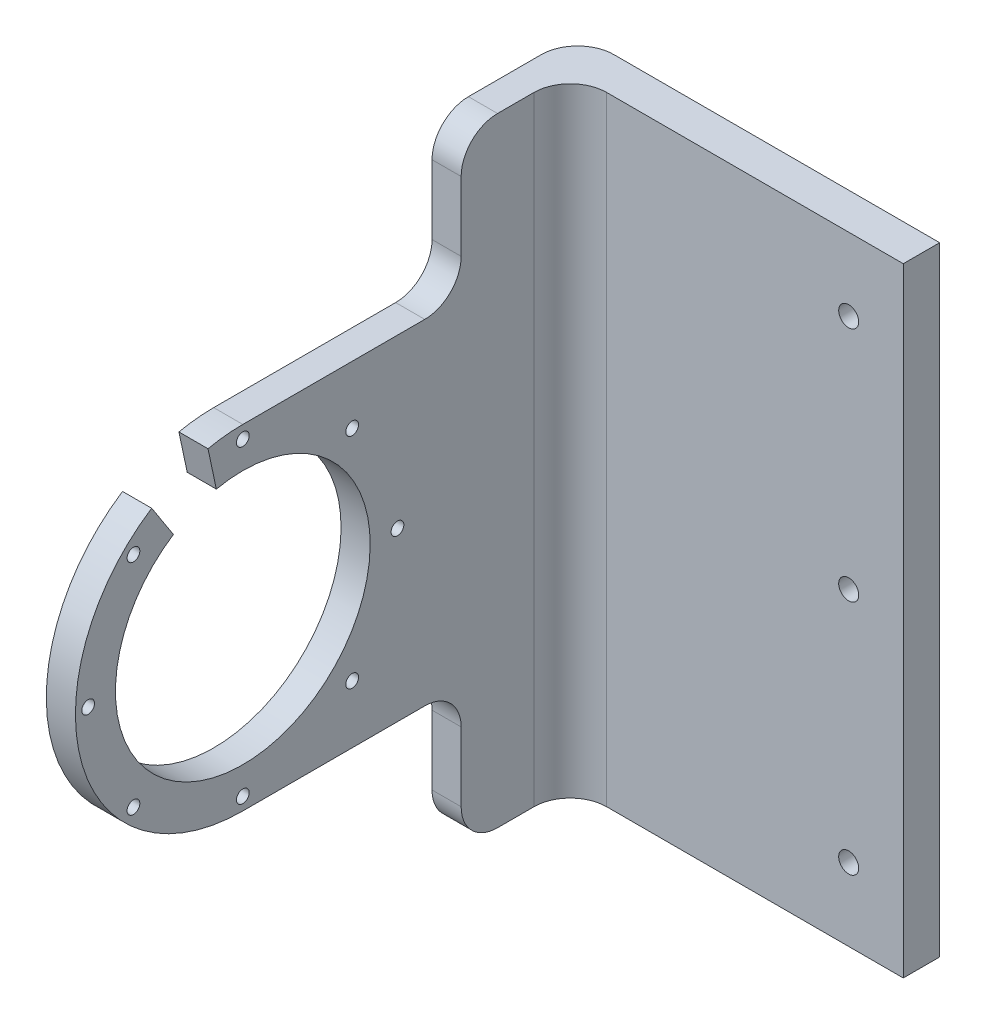
from build123d import *

# Parameters (mm, degrees)
EXTRUDE_1_DEPTH     = 170
SKETCH_2_R          = 35
CUT_EXTRUDE_1_DEPTH = 180
SKETCH_5_W          = 10
SKETCH_5_H          = 170
EXTRUDE_3_DEPTH     = 101.5
SKETCH_6_R          = 2.75
CUT_EXTRUDE_3_DEPTH = 52
FILLET_2_R          = 10
SKETCH_11_R         = 1.75
CUT_EXTRUDE_5_DEPTH = 10
CUT_EXTRUDE_6_DEPTH = 13
MOVE_FACE_2_BY      = 10
FILLET_3_R          = 10


with BuildPart() as part:
    # 草图1 → 凸台-拉伸1 (new body)
    with BuildSketch(Plane(origin=(0, 0, 0), x_dir=(1, 0, 0), z_dir=(0, 1, 0))):
        Polygon((8, -10), (8, -300), (0, -300), (0, 0), (8, 0), align=None)
    extrude(amount=EXTRUDE_1_DEPTH)

    # 草图2 → 切除-拉伸1 (cut)
    with BuildSketch(Plane(origin=(8, 0, 0), x_dir=(0, 0, -1), z_dir=(1, 0, 0))):
        with Locations((-100, 85)):
            Circle(SKETCH_2_R)
        with BuildLine():
            Line((-100, 131), (-40, 131))
            Line((-40, 131), (-40, 170))
            Line((-40, 170), (-300, 170))
            Line((-300, 170), (-300, 0))
            Line((-300, 0), (-40, 0))
            Line((-40, 0), (-40, 39))
            Line((-40, 39), (-100, 39))
            ThreePointArc((-100, 39), (-146, 85), (-100, 131))
        make_face()
    extrude(amount=-CUT_EXTRUDE_1_DEPTH, mode=Mode.SUBTRACT)

    # 草图5 → 凸台-拉伸3 (add)
    with BuildSketch(Plane(origin=(8, 0, 0), x_dir=(0, 0, -1), z_dir=(1, 0, 0))):
        with Locations((-5, 85)):
            Rectangle(SKETCH_5_W, SKETCH_5_H)
    extrude(amount=EXTRUDE_3_DEPTH)

    # 草图6 → 切除-拉伸3 (cut)
    with BuildSketch(Plane(origin=(0, 0, 0), x_dir=(-1, 0, 0), z_dir=(0, 0, -1))):
        with Locations((-84.5, 150)):
            Circle(SKETCH_6_R)
        with Locations((-84.5, 20)):
            Circle(SKETCH_6_R)
        with Locations((-84.5, 85)):
            Circle(SKETCH_6_R)
    extrude(amount=-CUT_EXTRUDE_3_DEPTH, mode=Mode.SUBTRACT)

    # 圆角2
    fillet_2_edges = [part.edges().sort_by_distance(p)[0] for p in [
        (4, 170, 40),
        (4, 131, 40),
        (4, 0, 40),
        (4, 39, 40),
    ]]
    fillet(fillet_2_edges, radius=FILLET_2_R)

    # 草图11 → 切除-拉伸5 (cut)
    with BuildSketch(Plane.ZY):
        with Locations((100, 42.5)):
            Circle(SKETCH_11_R)
        with Locations((69.9479618, 54.9479618)):
            Circle(SKETCH_11_R)
        with Locations((57.5, 85)):
            Circle(SKETCH_11_R)
        with Locations((69.9479618, 115.0520382)):
            Circle(SKETCH_11_R)
        with Locations((100, 127.5)):
            Circle(SKETCH_11_R)
        with Locations((130.0520382, 115.0520382)):
            Circle(SKETCH_11_R)
        with Locations((142.5, 85)):
            Circle(SKETCH_11_R)
        with Locations((130.0520382, 54.9479618)):
            Circle(SKETCH_11_R)
    extrude(amount=-CUT_EXTRUDE_5_DEPTH, mode=Mode.SUBTRACT)

    # 草图12 → 切除-拉伸6 (cut)
    with BuildSketch(Plane.ZY):
        with BuildLine():
            Line((100, 85), (110.395584541, 133.907380037))
            ThreePointArc((110.395584541, 133.907380037), (119.134171618, 131.193976626), (127.231951751, 126.933528397))
            Line((127.231951751, 126.933528397), (100, 85))
        make_face()
    extrude(amount=-CUT_EXTRUDE_6_DEPTH, mode=Mode.SUBTRACT)

    # Move Face 2: a face moved inward by 10.0
    extrude(part.faces().sort_by_distance((109.5, 85, 5))[0], amount=MOVE_FACE_2_BY, dir=(-1, 0, 0), mode=Mode.SUBTRACT)

    # 圆角3
    fillet_3_edges = [part.edges().sort_by_distance(p)[0] for p in [
        (0, 85, 0),
        (8, 85, 10),
    ]]
    fillet(fillet_3_edges, radius=FILLET_3_R)


solid = part.part
